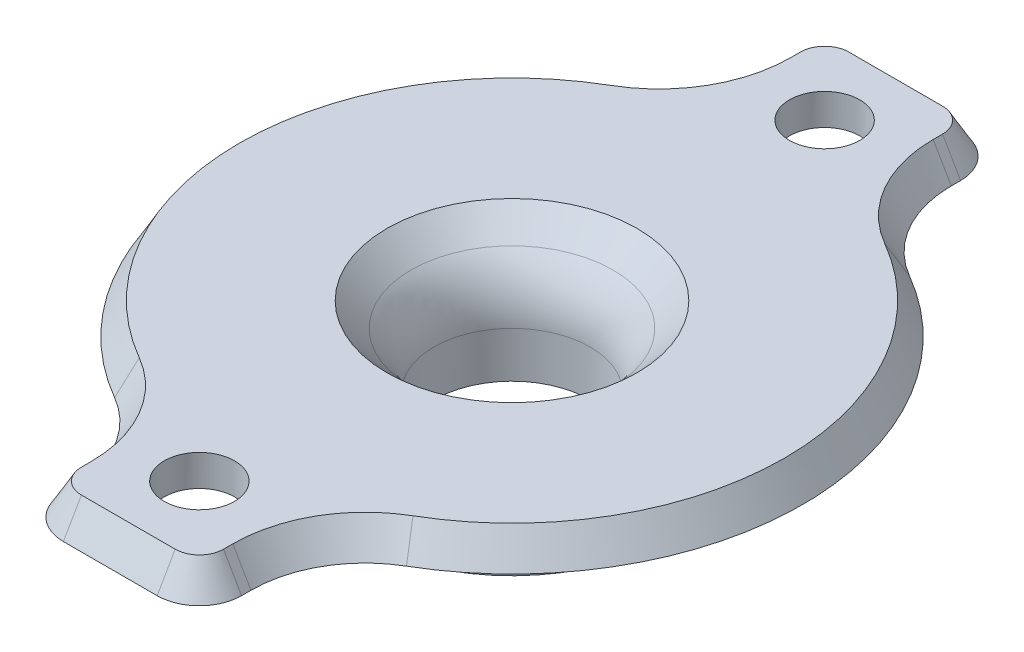
from build123d import *

# Parameters (mm, degrees)
BOSS_EXTRUDE1_START = -2
BOSS_EXTRUDE1_DEPTH = 2
CUT_EXTRUDE1_REACH  = 34.718
SKETCH2_3_R         = 2.25
FILLET1_R           = 7.3
FILLET2_R           = 2.7
CHAMFER1_SIZE       = 1.154700538
CHAMFER1_SIZE_2     = 2
CHAMFER2_SIZE       = 3
FILLET3_R           = 5
CHAMFER3_SIZE       = 2


with BuildPart() as part:
    # Sketch1 → Revolve1 (revolve)
    with BuildSketch(Plane.XY, mode=Mode.PRIVATE) as revolve1_sk:
        Polygon((-5, 0), (-5, 2), (-18.6, 2), (-18.6, 0), (-10.25, 0), (-10.25, -6), (-5, -6), align=None)
    revolve(revolve1_sk.sketch.rotate(Axis((0, 9.858601723, 0), (0, -1, 0)), 270), axis=Axis((0, 9.858601723, 0), (0, -1, 0)))

    # Sketch2 → Boss-Extrude1 (add)
    with BuildSketch(Plane(origin=(0, 2, 0), x_dir=(1, 0, 0), z_dir=(0, 1, 0)).offset(BOSS_EXTRUDE1_START)):
        with BuildLine():
            Line((-5.7, 25.7), (-5.7, 17.705084016))
            ThreePointArc((-5.7, 17.705084016), (-3.720937263, 18.224012343), (-1.696852692, 18.5224375))
            ThreePointArc((-1.696852692, 18.5224375), (-0.788854056, 22.10718041), (2.25, 20))
            ThreePointArc((2.25, 20), (2.10718041, 19.211145944), (1.696852692, 18.5224375))
            ThreePointArc((1.696852692, 18.5224375), (3.720937263, 18.224012343), (5.7, 17.705084016))
            Line((5.7, 17.705084016), (5.7, 25.7))
            Line((5.7, 25.7), (0.005376723, 25.7))
            Line((0.005376723, 25.7), (-0.005376723, 25.7))
            Line((-0.005376723, 25.7), (-5.7, 25.7))
        make_face()
        with BuildLine():
            ThreePointArc((-1.696852692, -18.5224375), (-3.720937263, -18.224012343), (-5.7, -17.705084016))
            Line((-5.7, -17.705084016), (-5.7, -25.7))
            Line((-5.7, -25.7), (-0.005376723, -25.7))
            Line((-0.005376723, -25.7), (0.005376723, -25.7))
            Line((0.005376723, -25.7), (5.7, -25.7))
            Line((5.7, -25.7), (5.7, -17.705084016))
            ThreePointArc((5.7, -17.705084016), (3.720937263, -18.224012343), (1.696852692, -18.5224375))
            ThreePointArc((1.696852692, -18.5224375), (2.10718041, -19.211145944), (2.25, -20))
            ThreePointArc((2.25, -20), (-0.788854056, -22.10718041), (-1.696852692, -18.5224375))
        make_face()
    extrude(amount=BOSS_EXTRUDE1_DEPTH)

    # Sketch2<3> → Cut-Extrude1 (cut, up to next)
    with BuildSketch(Plane(origin=(0, 2, 0), x_dir=(1, 0, 0), z_dir=(0, 1, 0)), mode=Mode.PRIVATE) as cut_extrude1_sk1:
        with Locations(Location((0, 20, 0), (0, 0, 270))):
            Circle(SKETCH2_3_R)
    cut_extrude1_tool1 = extrude(cut_extrude1_sk1.sketch, amount=-CUT_EXTRUDE1_REACH, mode=Mode.PRIVATE) & part.part
    # Sketch2<3> → Cut-Extrude1 (cut, up to next)
    with BuildSketch(Plane(origin=(0, 2, 0), x_dir=(1, 0, 0), z_dir=(0, 1, 0)), mode=Mode.PRIVATE) as cut_extrude1_sk2:
        with Locations(Location((0, -20, 0), (0, 0, 270))):
            Circle(SKETCH2_3_R)
    cut_extrude1_tool2 = extrude(cut_extrude1_sk2.sketch, amount=-CUT_EXTRUDE1_REACH, mode=Mode.PRIVATE) & part.part
    add(cut_extrude1_tool1.solids().sort_by_distance((0, 2, -20))[0], mode=Mode.SUBTRACT)
    add(cut_extrude1_tool2.solids().sort_by_distance((0, 2, 20))[0], mode=Mode.SUBTRACT)

    # Fillet1
    fillet1_edges = [part.edges().sort_by_distance(p)[0] for p in [
        (-5.7, 1, -17.705084016),
        (5.7, 1, -17.705084016),
        (-5.7, 1, 17.705084016),
        (5.7, 1, 17.705084016),
    ]]
    fillet(fillet1_edges, radius=FILLET1_R)

    # Fillet2
    fillet2_edges = [part.edges().sort_by_distance(p)[0] for p in [
        (-5.7, 1, -25.7),
        (5.7, 1, -25.7),
        (-5.7, 1, 25.7),
        (5.7, 1, 25.7),
    ]]
    fillet(fillet2_edges, radius=FILLET2_R)

    # Chamfer1
    # the kernel refuses this chamfer: 2, 1.154700538 mm, written as the material it takes off along each edge
    with BuildSketch(Plane(origin=(3, 2, 25.7), x_dir=(0, 0.05789386240267148, -0.9983227437537925), z_dir=(-1, 0, 0)), Plane(origin=(-3, 2, -25.7), x_dir=(0, 0.05789386240267148, 0.9983227437537925), z_dir=(1, 0, 0))) as chamfer1_piece_1:
        Polygon((CHAMFER1_SIZE * 0.998322744082, CHAMFER1_SIZE * 0.0578938624217), (-CHAMFER1_SIZE_2 * 0.0578938624027, CHAMFER1_SIZE_2 * 0.998322743754), (0, 0), align=None)
    extrude(amount=6, mode=Mode.SUBTRACT)
    with BuildSketch(Plane(origin=(5.7, 2, 23), x_dir=(-0.9983227437537925, 0.05789386240267148, 0), z_dir=(0, 0, -1)), Plane(origin=(-5.7, 2, 22.401116044), x_dir=(0.9983227437537925, 0.05789386240267148, 0), z_dir=(0, 0, 1)), Plane(origin=(5.7, 2, -22.401116044), x_dir=(-0.9983227437537925, 0.05789386240267148, 0), z_dir=(0, 0, -1)), Plane(origin=(-5.7, 2, -23), x_dir=(0.9983227437537925, 0.05789386240267148, 0), z_dir=(0, 0, 1))) as chamfer1_piece_2:
        Polygon((CHAMFER1_SIZE * 0.998322744082, -CHAMFER1_SIZE * 0.0578938624217), (-CHAMFER1_SIZE_2 * 0.0578938624027, -CHAMFER1_SIZE_2 * 0.998322743754), (0, 0), align=None)
    extrude(amount=0.598883956, mode=Mode.SUBTRACT)
    with BuildSketch(Plane(origin=(13, 2, 22.401116044), x_dir=(-1, 0, 0), z_dir=(0, 0, 1))) as chamfer1_piece_3:
        Polygon((7.3 + CHAMFER1_SIZE, 0), (7.3, CHAMFER1_SIZE_2), (7.3, 0), align=None)
    revolve(axis=Axis((13, 2, 22.401116044), (0, -1, 0)), revolution_arc=59.87219662, mode=Mode.SUBTRACT)
    with BuildSketch(Plane(origin=(-13, 2, 22.401116044), x_dir=(0.5019305019305016, 0, -0.8649079553523569), z_dir=(-0.8649079553523569, 0, -0.5019305019305016))) as chamfer1_piece_4:
        Polygon((7.3 + CHAMFER1_SIZE, 0), (7.3, CHAMFER1_SIZE_2), (7.3, 0), align=None)
    revolve(axis=Axis((-13, 2, 22.401116044), (0, -1, 0)), revolution_arc=59.87219662, mode=Mode.SUBTRACT)
    with BuildSketch(Plane(origin=(0, 2, 0), x_dir=(0.5019305019305017, 0, -0.8649079553523569), z_dir=(-0.8649079553523569, 0, -0.5019305019305017))) as chamfer1_piece_5:
        Polygon((18.6 - CHAMFER1_SIZE, 0), (18.6, CHAMFER1_SIZE_2), (18.6, 0), align=None)
    revolve(axis=Axis((0, 2, 0), (0, -1, 0)), revolution_arc=119.74439324, mode=Mode.SUBTRACT)
    with BuildSketch(Plane(origin=(0, 2, 0), x_dir=(-0.5019305019305019, 0, 0.8649079553523568), z_dir=(0.8649079553523568, 0, 0.5019305019305019))) as chamfer1_piece_6:
        Polygon((18.6 - CHAMFER1_SIZE, 0), (18.6, CHAMFER1_SIZE_2), (18.6, 0), align=None)
    revolve(axis=Axis((0, 2, 0), (0, -1, 0)), revolution_arc=119.74439324, mode=Mode.SUBTRACT)
    with BuildSketch(Plane(origin=(13, 2, -22.401116044), x_dir=(-1, 0, 0), z_dir=(0, 0, -1))) as chamfer1_piece_7:
        Polygon((7.3 + CHAMFER1_SIZE, 0), (7.3, -CHAMFER1_SIZE_2), (7.3, 0), align=None)
    revolve(axis=Axis((13, 2, -22.401116044), (0, 1, 0)), revolution_arc=59.87219662, mode=Mode.SUBTRACT)
    with BuildSketch(Plane(origin=(-13, 2, -22.401116044), x_dir=(0.5019305019305013, 0, 0.8649079553523572), z_dir=(-0.8649079553523572, 0, 0.5019305019305013))) as chamfer1_piece_8:
        Polygon((7.3 + CHAMFER1_SIZE, 0), (7.3, -CHAMFER1_SIZE_2), (7.3, 0), align=None)
    revolve(axis=Axis((-13, 2, -22.401116044), (0, 1, 0)), revolution_arc=59.87219662, mode=Mode.SUBTRACT)
    with BuildSketch(Plane(origin=(3, 2, 23), x_dir=(0, 0, 1), z_dir=(-1, 0, 0))) as chamfer1_piece_9:
        Polygon((2.7 - CHAMFER1_SIZE, 0), (2.7, -CHAMFER1_SIZE_2), (2.7, 0), align=None)
    revolve(axis=Axis((3, 2, 23), (0, 1, 0)), revolution_arc=90, mode=Mode.SUBTRACT)
    with BuildSketch(Plane(origin=(-3, 2, 23), x_dir=(-1, 0, 0), z_dir=(0, 0, -1))) as chamfer1_piece_10:
        Polygon((2.7 - CHAMFER1_SIZE, 0), (2.7, -CHAMFER1_SIZE_2), (2.7, 0), align=None)
    revolve(axis=Axis((-3, 2, 23), (0, 1, 0)), revolution_arc=90, mode=Mode.SUBTRACT)
    with BuildSketch(Plane(origin=(3, 2, -23), x_dir=(0, 0, -1), z_dir=(-1, 0, 0))) as chamfer1_piece_11:
        Polygon((2.7 - CHAMFER1_SIZE, 0), (2.7, CHAMFER1_SIZE_2), (2.7, 0), align=None)
    revolve(axis=Axis((3, 2, -23), (0, -1, 0)), revolution_arc=90, mode=Mode.SUBTRACT)
    with BuildSketch(Plane(origin=(-3, 2, -23), x_dir=(-1, 0, 0), z_dir=(0, 0, 1))) as chamfer1_piece_12:
        Polygon((2.7 - CHAMFER1_SIZE, 0), (2.7, CHAMFER1_SIZE_2), (2.7, 0), align=None)
    revolve(axis=Axis((-3, 2, -23), (0, -1, 0)), revolution_arc=90, mode=Mode.SUBTRACT)

    # Chamfer2
    chamfer2_edges = [part.edges().sort_by_distance(p)[0] for p in [
        (0, 2, -5),
    ]]
    chamfer(chamfer2_edges, length=CHAMFER2_SIZE)

    # Fillet3
    fillet3_edges = [part.edges().sort_by_distance(p)[0] for p in [
        (0, -1, -5),
    ]]
    fillet(fillet3_edges, radius=FILLET3_R)

    # Chamfer3
    chamfer3_edges = [part.edges().sort_by_distance(p)[0] for p in [
        (0, 0, -10.25),
    ]]
    chamfer(chamfer3_edges, length=CHAMFER3_SIZE)


solid = part.part
